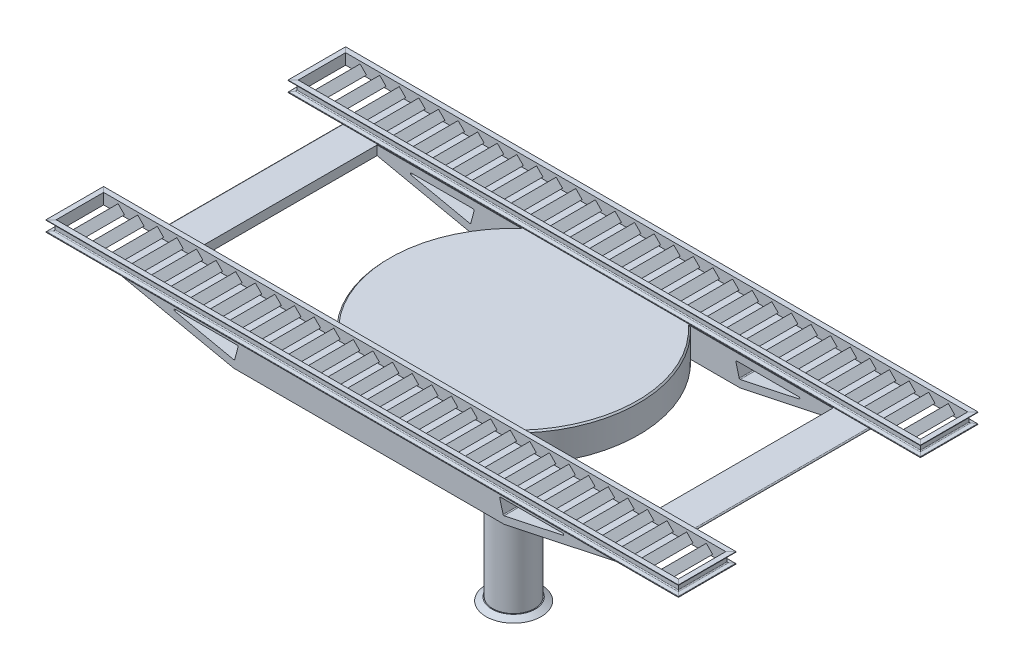
from build123d import *

# Parameters (mm, degrees)
SKETCH2_R                      = 146.161759817
BOSS_EXTRUDE1_DEPTH            = 1422.4
EXTRUDE_80_DEPTH               = 1016
CUT_EXTRUDE1_DEPTH             = 762
CUT_EXTRUDE2_DEPTH             = 3238.534356525
FILLET2_R                      = 6.35
FILLET3_R                      = 6.35
CHAMFER1_SIZE                  = 10
C_CHANNEL_C3X4_1_1_DEPTH       = 418.046981076
C_CHANNEL_C3X4_1_1_DEPTH_BACK  = 85.196689935
C_CHANNEL_C3X4_1_1_2_DEPTH     = 4539.061944792
C_CHANNEL_C3X4_1_1_3_DEPTH     = 503.24367101
C_CHANNEL_C3X4_1_1_4_DEPTH     = 4539.061944792
L_ANGLE_L2_5X2_5X0_375_1_DEPTH = 332.850291141
LPATTERN1_COUNT                = 31
LPATTERN1_PITCH                = 137.668


with BuildPart() as part:
    # Sketch1 → Revolve1 (revolve)
    with BuildSketch(Plane.XY, mode=Mode.PRIVATE) as revolve1_sk:
        Polygon((0, 0), (-193.78013245, 0), (-152.4, 24.727152318), (0, 24.727152318), align=None)
    revolve(revolve1_sk.sketch.rotate(Axis((0, 24.727152318, 0), (0, -1, 0)), 270), axis=Axis((0, 24.727152318, 0), (0, -1, 0)))


with BuildPart() as body_2:
    # Sketch2 → Boss-Extrude1 (new body)
    with BuildSketch(Plane(origin=(0, 24.727152318, 0), x_dir=(1, 0, 0), z_dir=(0, 1, 0))):
        with Locations(Location((0, 0, 0), (0, 0, 270))):
            Circle(SKETCH2_R)
    extrude(amount=BOSS_EXTRUDE1_DEPTH)


with BuildPart() as body_3:
    # Sketch3 → 80 (new, symmetric)
    with BuildSketch(Plane.XY):
        Polygon((949.019161754, 1447.127152318), (-949.019161754, 1447.127152318), (-1905, 1650.327152318), (1905, 1650.327152318), align=None)
    extrude(amount=EXTRUDE_80_DEPTH, both=True)

    # Sketch4 → Cut-Extrude1 (cut, symmetric)
    with BuildSketch(Plane(origin=(0, 1650.327152318, 0), x_dir=(1, 0, 0), z_dir=(0, 1, 0))):
        with BuildLine():
            ThreePointArc((600.003574056, 641.560449419), (878.409983515, 0), (600.003574056, -641.560449419))
            Line((600.003574056, -641.560449419), (1600.152439785, -641.560449419))
            Line((1600.152439785, -641.560449419), (1600.152439785, 641.560449419))
            Line((1600.152439785, 641.560449419), (600.003574056, 641.560449419))
        make_face()
        with BuildLine():
            Line((-1600.152439785, -641.560449419), (-600.003574056, -641.560449419))
            ThreePointArc((-600.003574056, -641.560449419), (-878.409983515, 0), (-600.003574056, 641.560449419))
            Line((-600.003574056, 641.560449419), (-1600.152439785, 641.560449419))
            Line((-1600.152439785, 641.560449419), (-1600.152439785, -641.560449419))
        make_face()
    extrude(amount=CUT_EXTRUDE1_DEPTH, both=True, mode=Mode.SUBTRACT)

    # Sketch5 → Cut-Extrude2 (cut, symmetric)
    with BuildSketch(Plane.XY.offset(1016)):
        Polygon((-1421.670285725, 1599.527152318), (-916.560412499, 1599.527152318), (-943.679866602, 1497.927152318), align=None)
    cut_extrude2 = extrude(amount=CUT_EXTRUDE2_DEPTH, both=True, mode=Mode.SUBTRACT)

    # Mirror1: Cut-Extrude2 across plane
    add(cut_extrude2.mirror(Plane(origin=(0, 0, 0), x_dir=(0, 0, 1), z_dir=(1, 0, 0))), mode=Mode.SUBTRACT)

    # Fillet2
    fillet2_edges = [body_3.edges().sort_by_distance(p)[0] for p in [
        (-1421.670285725, 1599.527152318, 828.780224709),
        (-1421.670285725, 1599.527152318, -828.780224709),
        (-916.560412499, 1599.527152318, 828.780224709),
        (-916.560412499, 1599.527152318, -828.780224709),
        (-943.679866602, 1497.927152318, 828.780224709),
        (-943.679866602, 1497.927152318, -828.780224709),
        (916.560412499, 1599.527152318, 828.780224709),
        (916.560412499, 1599.527152318, -828.780224709),
        (1421.670285725, 1599.527152318, 828.780224709),
        (1421.670285725, 1599.527152318, -828.780224709),
        (943.679866602, 1497.927152318, 828.780224709),
        (943.679866602, 1497.927152318, -828.780224709),
    ]]
    fillet(fillet2_edges, radius=FILLET2_R)

    # Fillet3
    fillet3_edges = [body_3.edges().sort_by_distance(p)[0] for p in [
        (949.019161754, 1447.127152318, -828.780224709),
        (-949.019161754, 1447.127152318, -828.780224709),
        (-1905, 1650.327152318, 0),
        (1905, 1650.327152318, 0),
        (949.019161754, 1447.127152318, 828.780224709),
        (-949.019161754, 1447.127152318, 828.780224709),
    ]]
    fillet(fillet3_edges, radius=FILLET3_R)

    # Chamfer1
    # the kernel refuses this chamfer: 10 mm, written as the material it takes off along each edge
    with BuildSketch(Plane(origin=(0, 1650.327152318, 0), x_dir=(0.6613745725772139, 0, 0.7500557810911851), z_dir=(-0.7500557810911851, 0, 0.6613745725772139))) as chamfer1_piece_1_section:
        Polygon((878.409983515 - CHAMFER1_SIZE, 0), (878.409983515, -CHAMFER1_SIZE), (878.409983515, 0), align=None)
    chamfer1_piece_1 = revolve(axis=Axis((0, 1650.327152318, 0), (0, 1, 0)), revolution_arc=97.190420103, mode=Mode.PRIVATE)
    chamfer1_piece_1 = split(chamfer1_piece_1, bisect_by=Plane(origin=(873.713706832, 1645.630875636, -641.560449419), z_dir=(0, 0, 1)), keep=Keep.TOP, mode=Mode.PRIVATE)
    chamfer1_piece_1 = split(chamfer1_piece_1, bisect_by=Plane(origin=(873.713706832, 1645.630875636, 641.560449419), z_dir=(0, 0, -1)), keep=Keep.TOP, mode=Mode.PRIVATE)
    add(chamfer1_piece_1, mode=Mode.SUBTRACT)
    with BuildSketch(Plane(origin=(0, 1650.327152318, 0), x_dir=(-0.6613745725772333, 0, -0.7500557810911678), z_dir=(0.7500557810911678, 0, -0.6613745725772333))) as chamfer1_piece_2_section:
        Polygon((878.409983515 - CHAMFER1_SIZE, 0), (878.409983515, -CHAMFER1_SIZE), (878.409983515, 0), align=None)
    chamfer1_piece_2 = revolve(axis=Axis((0, 1650.327152318, 0), (0, 1, 0)), revolution_arc=97.190420103, mode=Mode.PRIVATE)
    chamfer1_piece_2 = split(chamfer1_piece_2, bisect_by=Plane(origin=(-873.713706833, 1645.630875636, -641.560449419), z_dir=(0, 0, 1)), keep=Keep.TOP, mode=Mode.PRIVATE)
    chamfer1_piece_2 = split(chamfer1_piece_2, bisect_by=Plane(origin=(-873.713706833, 1645.630875636, 641.560449419), z_dir=(0, 0, -1)), keep=Keep.TOP, mode=Mode.PRIVATE)
    add(chamfer1_piece_2, mode=Mode.SUBTRACT)


with BuildPart() as body_4:
    # Sketch16 → C channel C3X4.1(1) (new, two sides: drawn at the far end of the back side and taken through both)
    with BuildSketch(Plane(origin=(-2195.781484513, 1650.327152318, -683.149708859), x_dir=(-1, 0, 0), z_dir=(0, 0, -1)).offset(-C_CHANNEL_C3X4_1_1_DEPTH_BACK)):
        with BuildLine():
            Line((0, 0), (0, 76.2))
            Line((0, 76.2), (35.814, 76.2))
            Line((35.814, 76.2), (35.814, 74.168))
            ThreePointArc((35.814, 74.168), (35.212080466, 72.526219227), (33.691603066, 71.662564373))
            Line((33.691603066, 71.662564373), (10.048471721, 67.721755022))
            ThreePointArc((10.048471721, 67.721755022), (5.943182741, 65.389886916), (4.318, 60.95707883))
            Line((4.318, 60.95707883), (4.318, 15.24292117))
            ThreePointArc((4.318, 15.24292117), (5.943182741, 10.810113084), (10.048471721, 8.478244978))
            Line((10.048471721, 8.478244978), (33.691603066, 4.537435627))
            ThreePointArc((33.691603066, 4.537435627), (35.212080466, 3.673780773), (35.814, 2.032))
            Line((35.814, 2.032), (35.814, 0))
            Line((35.814, 0), (0, 0))
        make_face()
    extrude(amount=C_CHANNEL_C3X4_1_1_DEPTH + C_CHANNEL_C3X4_1_1_DEPTH_BACK)

    # C channel C3X4.1(1) mitre 1
    split(bisect_by=Plane(origin=(-2195.781484513, 1650.327152318, -683.149708859), x_dir=(0, -1, 0), z_dir=(-0.707106781, 0, -0.707106781)), keep=Keep.TOP)

    # C channel C3X4.1(1) mitre 2
    split(bisect_by=Plane(origin=(-2195.781484513, 1650.327152318, -1016), x_dir=(0, -1, 0), z_dir=(-0.707106781, 0, 0.707106781)), keep=Keep.TOP)


with BuildPart() as body_5:
    # Sketch16 on segment 2 (carried to segment 2) → C channel C3X4.1_1 2 (new body)
    with BuildSketch(Plane(origin=(-2280.978174448, 1650.327152318, -1016), x_dir=(0, 0, -1), z_dir=(1, 0, 0))):
        with BuildLine():
            Line((0, 0), (0, 76.2))
            Line((0, 76.2), (35.814, 76.2))
            Line((35.814, 76.2), (35.814, 74.168))
            ThreePointArc((35.814, 74.168), (35.212080466, 72.526219227), (33.691603066, 71.662564373))
            Line((33.691603066, 71.662564373), (10.048471721, 67.721755022))
            ThreePointArc((10.048471721, 67.721755022), (5.943182741, 65.389886916), (4.318, 60.95707883))
            Line((4.318, 60.95707883), (4.318, 15.24292117))
            ThreePointArc((4.318, 15.24292117), (5.943182741, 10.810113084), (10.048471721, 8.478244978))
            Line((10.048471721, 8.478244978), (33.691603066, 4.537435627))
            ThreePointArc((33.691603066, 4.537435627), (35.212080466, 3.673780773), (35.814, 2.032))
            Line((35.814, 2.032), (35.814, 0))
            Line((35.814, 0), (0, 0))
        make_face()
    extrude(amount=C_CHANNEL_C3X4_1_1_2_DEPTH)

    # C channel C3X4.1_1 2 mitre 1
    split(bisect_by=Plane(origin=(-2195.781484513, 1650.327152318, -1016), x_dir=(0, 1, 0), z_dir=(0.707106781, 0, -0.707106781)), keep=Keep.TOP)

    # C channel C3X4.1_1 2 mitre 2
    split(bisect_by=Plane(origin=(2172.887080409, 1650.327152318, -1016), x_dir=(0, -1, 0), z_dir=(-0.707106781, 0, -0.707106781)), keep=Keep.TOP)


with BuildPart() as body_6:
    # Sketch16 on segment 3 (carried to segment 3) → C channel C3X4.1_1 3 (new body)
    with BuildSketch(Plane(origin=(2172.887080409, 1650.327152318, -1101.196689935), x_dir=(1, 0, 0), z_dir=(0, 0, 1))):
        with BuildLine():
            Line((0, 0), (0, 76.2))
            Line((0, 76.2), (35.814, 76.2))
            Line((35.814, 76.2), (35.814, 74.168))
            ThreePointArc((35.814, 74.168), (35.212080466, 72.526219227), (33.691603066, 71.662564373))
            Line((33.691603066, 71.662564373), (10.048471721, 67.721755022))
            ThreePointArc((10.048471721, 67.721755022), (5.943182741, 65.389886916), (4.318, 60.95707883))
            Line((4.318, 60.95707883), (4.318, 15.24292117))
            ThreePointArc((4.318, 15.24292117), (5.943182741, 10.810113084), (10.048471721, 8.478244978))
            Line((10.048471721, 8.478244978), (33.691603066, 4.537435627))
            ThreePointArc((33.691603066, 4.537435627), (35.212080466, 3.673780773), (35.814, 2.032))
            Line((35.814, 2.032), (35.814, 0))
            Line((35.814, 0), (0, 0))
        make_face()
    extrude(amount=C_CHANNEL_C3X4_1_1_3_DEPTH)

    # C channel C3X4.1_1 3 mitre 1
    split(bisect_by=Plane(origin=(2172.887080409, 1650.327152318, -1016), x_dir=(0, 1, 0), z_dir=(0.707106781, 0, 0.707106781)), keep=Keep.TOP)

    # C channel C3X4.1_1 3 mitre 2
    split(bisect_by=Plane(origin=(2172.887080409, 1650.327152318, -683.149708859), x_dir=(0, 1, 0), z_dir=(0.707106781, 0, -0.707106781)), keep=Keep.TOP)


with BuildPart() as body_7:
    # Sketch16 on segment 4 (carried to segment 4) → C channel C3X4.1_1 4 (new body)
    with BuildSketch(Plane(origin=(2258.083770344, 1650.327152318, -683.149708859), x_dir=(0, 0, 1), z_dir=(-1, 0, 0))):
        with BuildLine():
            Line((0, 0), (0, 76.2))
            Line((0, 76.2), (35.814, 76.2))
            Line((35.814, 76.2), (35.814, 74.168))
            ThreePointArc((35.814, 74.168), (35.212080466, 72.526219227), (33.691603066, 71.662564373))
            Line((33.691603066, 71.662564373), (10.048471721, 67.721755022))
            ThreePointArc((10.048471721, 67.721755022), (5.943182741, 65.389886916), (4.318, 60.95707883))
            Line((4.318, 60.95707883), (4.318, 15.24292117))
            ThreePointArc((4.318, 15.24292117), (5.943182741, 10.810113084), (10.048471721, 8.478244978))
            Line((10.048471721, 8.478244978), (33.691603066, 4.537435627))
            ThreePointArc((33.691603066, 4.537435627), (35.212080466, 3.673780773), (35.814, 2.032))
            Line((35.814, 2.032), (35.814, 0))
            Line((35.814, 0), (0, 0))
        make_face()
    extrude(amount=C_CHANNEL_C3X4_1_1_4_DEPTH)

    # C channel C3X4.1_1 4 mitre 1
    split(bisect_by=Plane(origin=(2172.887080409, 1650.327152318, -683.149708859), x_dir=(0, -1, 0), z_dir=(-0.707106781, 0, 0.707106781)), keep=Keep.TOP)

    # C channel C3X4.1_1 4 mitre 2
    split(bisect_by=Plane(origin=(-2195.781484513, 1650.327152318, -683.149708859), x_dir=(0, 1, 0), z_dir=(0.707106781, 0, 0.707106781)), keep=Keep.TOP)


with BuildPart() as body_8:
    # Sketch110 → L angle L2.5X2.5X0.375(1) (new body)
    with BuildSketch(Plane(origin=(-2094.181484513, 1708.63272859, -1016), x_dir=(-0.7071067811865414, -0.7071067811865537, 0), z_dir=(0, 0, 1))):
        with BuildLine():
            Line((0, 0), (0, 63.5))
            Line((0, 63.5), (4.76758, 63.5))
            ThreePointArc((4.76758, 63.5), (8.131583943, 62.106583943), (9.525, 58.74258))
            Line((9.525, 58.74258), (9.525, 14.2875))
            ThreePointArc((9.525, 14.2875), (10.919903955, 10.919903955), (14.2875, 9.525))
            Line((14.2875, 9.525), (58.74258, 9.525))
            ThreePointArc((58.74258, 9.525), (62.106583943, 8.131583943), (63.5, 4.76758))
            Line((63.5, 4.76758), (63.5, 0))
            Line((63.5, 0), (0, 0))
        make_face()
    extrude(amount=L_ANGLE_L2_5X2_5X0_375_1_DEPTH)


with BuildPart() as lpattern1_1:
    # LPattern1: pattern copy
    add(body_8.part.moved(Location(Vector(1, 0, 0) * (1 * LPATTERN1_PITCH))))


with BuildPart() as lpattern1_2:
    # LPattern1: pattern copy
    add(body_8.part.moved(Location(Vector(1, 0, 0) * (2 * LPATTERN1_PITCH))))


with BuildPart() as lpattern1_3:
    # LPattern1: pattern copy
    add(body_8.part.moved(Location(Vector(1, 0, 0) * (3 * LPATTERN1_PITCH))))


with BuildPart() as lpattern1_4:
    # LPattern1: pattern copy
    add(body_8.part.moved(Location(Vector(1, 0, 0) * (4 * LPATTERN1_PITCH))))


with BuildPart() as lpattern1_5:
    # LPattern1: pattern copy
    add(body_8.part.moved(Location(Vector(1, 0, 0) * (5 * LPATTERN1_PITCH))))


with BuildPart() as lpattern1_6:
    # LPattern1: pattern copy
    add(body_8.part.moved(Location(Vector(1, 0, 0) * (6 * LPATTERN1_PITCH))))


with BuildPart() as lpattern1_7:
    # LPattern1: pattern copy
    add(body_8.part.moved(Location(Vector(1, 0, 0) * (7 * LPATTERN1_PITCH))))


with BuildPart() as lpattern1_8:
    # LPattern1: pattern copy
    add(body_8.part.moved(Location(Vector(1, 0, 0) * (8 * LPATTERN1_PITCH))))


with BuildPart() as lpattern1_9:
    # LPattern1: pattern copy
    add(body_8.part.moved(Location(Vector(1, 0, 0) * (9 * LPATTERN1_PITCH))))


with BuildPart() as lpattern1_10:
    # LPattern1: pattern copy
    add(body_8.part.moved(Location(Vector(1, 0, 0) * (10 * LPATTERN1_PITCH))))


with BuildPart() as lpattern1_11:
    # LPattern1: pattern copy
    add(body_8.part.moved(Location(Vector(1, 0, 0) * (11 * LPATTERN1_PITCH))))


with BuildPart() as lpattern1_12:
    # LPattern1: pattern copy
    add(body_8.part.moved(Location(Vector(1, 0, 0) * (12 * LPATTERN1_PITCH))))


with BuildPart() as lpattern1_13:
    # LPattern1: pattern copy
    add(body_8.part.moved(Location(Vector(1, 0, 0) * (13 * LPATTERN1_PITCH))))


with BuildPart() as lpattern1_14:
    # LPattern1: pattern copy
    add(body_8.part.moved(Location(Vector(1, 0, 0) * (14 * LPATTERN1_PITCH))))


with BuildPart() as lpattern1_15:
    # LPattern1: pattern copy
    add(body_8.part.moved(Location(Vector(1, 0, 0) * (15 * LPATTERN1_PITCH))))


with BuildPart() as lpattern1_16:
    # LPattern1: pattern copy
    add(body_8.part.moved(Location(Vector(1, 0, 0) * (16 * LPATTERN1_PITCH))))


with BuildPart() as lpattern1_17:
    # LPattern1: pattern copy
    add(body_8.part.moved(Location(Vector(1, 0, 0) * (17 * LPATTERN1_PITCH))))


with BuildPart() as lpattern1_18:
    # LPattern1: pattern copy
    add(body_8.part.moved(Location(Vector(1, 0, 0) * (18 * LPATTERN1_PITCH))))


with BuildPart() as lpattern1_19:
    # LPattern1: pattern copy
    add(body_8.part.moved(Location(Vector(1, 0, 0) * (19 * LPATTERN1_PITCH))))


with BuildPart() as lpattern1_20:
    # LPattern1: pattern copy
    add(body_8.part.moved(Location(Vector(1, 0, 0) * (20 * LPATTERN1_PITCH))))


with BuildPart() as lpattern1_21:
    # LPattern1: pattern copy
    add(body_8.part.moved(Location(Vector(1, 0, 0) * (21 * LPATTERN1_PITCH))))


with BuildPart() as lpattern1_22:
    # LPattern1: pattern copy
    add(body_8.part.moved(Location(Vector(1, 0, 0) * (22 * LPATTERN1_PITCH))))


with BuildPart() as lpattern1_23:
    # LPattern1: pattern copy
    add(body_8.part.moved(Location(Vector(1, 0, 0) * (23 * LPATTERN1_PITCH))))


with BuildPart() as lpattern1_24:
    # LPattern1: pattern copy
    add(body_8.part.moved(Location(Vector(1, 0, 0) * (24 * LPATTERN1_PITCH))))


with BuildPart() as lpattern1_25:
    # LPattern1: pattern copy
    add(body_8.part.moved(Location(Vector(1, 0, 0) * (25 * LPATTERN1_PITCH))))


with BuildPart() as lpattern1_26:
    # LPattern1: pattern copy
    add(body_8.part.moved(Location(Vector(1, 0, 0) * (26 * LPATTERN1_PITCH))))


with BuildPart() as lpattern1_27:
    # LPattern1: pattern copy
    add(body_8.part.moved(Location(Vector(1, 0, 0) * (27 * LPATTERN1_PITCH))))


with BuildPart() as lpattern1_28:
    # LPattern1: pattern copy
    add(body_8.part.moved(Location(Vector(1, 0, 0) * (28 * LPATTERN1_PITCH))))


with BuildPart() as lpattern1_29:
    # LPattern1: pattern copy
    add(body_8.part.moved(Location(Vector(1, 0, 0) * (29 * LPATTERN1_PITCH))))


with BuildPart() as lpattern1_30:
    # LPattern1: pattern copy
    add(body_8.part.moved(Location(Vector(1, 0, 0) * (30 * LPATTERN1_PITCH))))


with BuildPart() as body_39:
    # Mirror2: mirrored copy
    add(body_8.part.mirror(Plane.XY))


with BuildPart() as body_40:
    # Mirror2 2: mirrored copy
    add(lpattern1_1.part.mirror(Plane.XY))


with BuildPart() as body_41:
    # Mirror2 3: mirrored copy
    add(lpattern1_2.part.mirror(Plane.XY))


with BuildPart() as body_42:
    # Mirror2 4: mirrored copy
    add(lpattern1_3.part.mirror(Plane.XY))


with BuildPart() as body_43:
    # Mirror2 5: mirrored copy
    add(lpattern1_4.part.mirror(Plane.XY))


with BuildPart() as body_44:
    # Mirror2 6: mirrored copy
    add(lpattern1_5.part.mirror(Plane.XY))


with BuildPart() as body_45:
    # Mirror2 7: mirrored copy
    add(lpattern1_6.part.mirror(Plane.XY))


with BuildPart() as body_46:
    # Mirror2 8: mirrored copy
    add(lpattern1_7.part.mirror(Plane.XY))


with BuildPart() as body_47:
    # Mirror2 9: mirrored copy
    add(lpattern1_8.part.mirror(Plane.XY))


with BuildPart() as body_48:
    # Mirror2 10: mirrored copy
    add(lpattern1_9.part.mirror(Plane.XY))


with BuildPart() as body_49:
    # Mirror2 11: mirrored copy
    add(lpattern1_10.part.mirror(Plane.XY))


with BuildPart() as body_50:
    # Mirror2 12: mirrored copy
    add(lpattern1_11.part.mirror(Plane.XY))


with BuildPart() as body_51:
    # Mirror2 13: mirrored copy
    add(lpattern1_12.part.mirror(Plane.XY))


with BuildPart() as body_52:
    # Mirror2 14: mirrored copy
    add(lpattern1_13.part.mirror(Plane.XY))


with BuildPart() as body_53:
    # Mirror2 15: mirrored copy
    add(lpattern1_14.part.mirror(Plane.XY))


with BuildPart() as body_54:
    # Mirror2 16: mirrored copy
    add(lpattern1_15.part.mirror(Plane.XY))


with BuildPart() as body_55:
    # Mirror2 17: mirrored copy
    add(lpattern1_16.part.mirror(Plane.XY))


with BuildPart() as body_56:
    # Mirror2 18: mirrored copy
    add(lpattern1_17.part.mirror(Plane.XY))


with BuildPart() as body_57:
    # Mirror2 19: mirrored copy
    add(lpattern1_18.part.mirror(Plane.XY))


with BuildPart() as body_58:
    # Mirror2 20: mirrored copy
    add(lpattern1_19.part.mirror(Plane.XY))


with BuildPart() as body_59:
    # Mirror2 21: mirrored copy
    add(lpattern1_20.part.mirror(Plane.XY))


with BuildPart() as body_60:
    # Mirror2 22: mirrored copy
    add(lpattern1_21.part.mirror(Plane.XY))


with BuildPart() as body_61:
    # Mirror2 23: mirrored copy
    add(lpattern1_22.part.mirror(Plane.XY))


with BuildPart() as body_62:
    # Mirror2 24: mirrored copy
    add(lpattern1_23.part.mirror(Plane.XY))


with BuildPart() as body_63:
    # Mirror2 25: mirrored copy
    add(lpattern1_24.part.mirror(Plane.XY))


with BuildPart() as body_64:
    # Mirror2 26: mirrored copy
    add(lpattern1_25.part.mirror(Plane.XY))


with BuildPart() as body_65:
    # Mirror2 27: mirrored copy
    add(body_5.part.mirror(Plane.XY))


with BuildPart() as body_66:
    # Mirror2 28: mirrored copy
    add(lpattern1_26.part.mirror(Plane.XY))


with BuildPart() as body_67:
    # Mirror2 29: mirrored copy
    add(lpattern1_27.part.mirror(Plane.XY))


with BuildPart() as body_68:
    # Mirror2 30: mirrored copy
    add(lpattern1_28.part.mirror(Plane.XY))


with BuildPart() as body_69:
    # Mirror2 31: mirrored copy
    add(lpattern1_29.part.mirror(Plane.XY))


with BuildPart() as body_70:
    # Mirror2 32: mirrored copy
    add(lpattern1_30.part.mirror(Plane.XY))


with BuildPart() as body_71:
    # Mirror2 33: mirrored copy
    add(body_6.part.mirror(Plane.XY))


with BuildPart() as body_72:
    # Mirror2 34: mirrored copy
    add(body_7.part.mirror(Plane.XY))


with BuildPart() as body_73:
    # Mirror2 35: mirrored copy
    add(body_4.part.mirror(Plane.XY))


solid = Compound([part.part, body_2.part, body_3.part, body_4.part, body_5.part, body_6.part, body_7.part, body_8.part, lpattern1_1.part, lpattern1_2.part, lpattern1_3.part, lpattern1_4.part, lpattern1_5.part, lpattern1_6.part, lpattern1_7.part, lpattern1_8.part, lpattern1_9.part, lpattern1_10.part, lpattern1_11.part, lpattern1_12.part, lpattern1_13.part, lpattern1_14.part, lpattern1_15.part, lpattern1_16.part, lpattern1_17.part, lpattern1_18.part, lpattern1_19.part, lpattern1_20.part, lpattern1_21.part, lpattern1_22.part, lpattern1_23.part, lpattern1_24.part, lpattern1_25.part, lpattern1_26.part, lpattern1_27.part, lpattern1_28.part, lpattern1_29.part, lpattern1_30.part, body_39.part, body_40.part, body_41.part, body_42.part, body_43.part, body_44.part, body_45.part, body_46.part, body_47.part, body_48.part, body_49.part, body_50.part, body_51.part, body_52.part, body_53.part, body_54.part, body_55.part, body_56.part, body_57.part, body_58.part, body_59.part, body_60.part, body_61.part, body_62.part, body_63.part, body_64.part, body_65.part, body_66.part, body_67.part, body_68.part, body_69.part, body_70.part, body_71.part, body_72.part, body_73.part])
